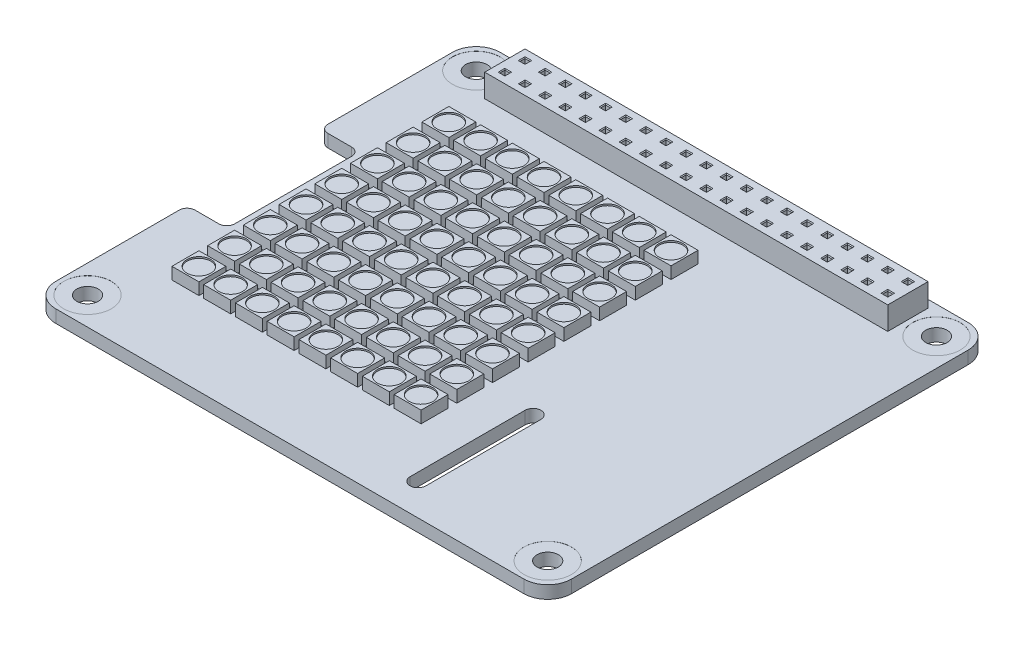
from build123d import *

# Parameters (mm, degrees)
BASES_W                    = 85
BASES_H                    = 56
BASE_DEPTH                 = 0.8
M2_5_CLEARANCE_HOLE_D      = 2.7
FASTENERAREA_START         = -0.01
FASTENERAREAS_R            = 3
FASTENERAREAS_R_2          = 1.35
FASTENERAREA_DEPTH         = 0.01
HLP_FASTENERHOLES_COUNT    = 2
HLP_FASTENERHOLES_PITCH    = 58
VM_FA_COPY_1_D             = 2.7
VM_START                   = -0.01
VM_FA_COPY_2_SKETCH_R      = 3
VM_FA_COPY_2_SKETCH_R_2    = 1.35
VM_FA_COPY_2_DEPTH         = 0.01
VM_FA_COPY_3_D             = 2.7
F_1_0_1_DIAMETER_HOLE_IO_D = 1
LP_DIAHOLE_IO_COUNT        = 20
LP_DIAHOLE_IO_PITCH        = 2.54
LP_DIAHOLE_IO_COUNT_DIR2   = 2
LP_DIAHOLE_IO_PITCH_DIR2   = 2.54
CORNERRADIUS_R             = 3
CUT_EXTRUDE1_DEPTH         = 51.919642575
FILLET1_R                  = 3
SKETCH10_W                 = 5
SKETCH10_H                 = 16.75
CUT_EXTRUDE2_DEPTH         = 51.919642575
FILLET2_R                  = 1
CUT_EXTRUDE3_DEPTH         = 51.919642575
SKETCH12_W                 = 50.8
SKETCH12_H                 = 5.08
BOSS_EXTRUDE1_DEPTH        = 5.8
SKETCH14_W                 = 0.64
SKETCH14_H                 = 0.64
CUT_EXTRUDE4_DEPTH         = 5.8
CHAMFER1_SIZE              = 0.3
LPATTERN1_COUNT            = 20
LPATTERN1_PITCH            = 2.54
LPATTERN1_COUNT_DIR2       = 2
LPATTERN1_PITCH_DIR2       = 2.54
CHAMFER1_OF_LPATTERN1_SIZE = 0.3
SKETCH15_W                 = 50.8
SKETCH15_H                 = 5.08
BOSS_EXTRUDE2_DEPTH        = 2.9
SKETCH16_W                 = 0.64
SKETCH16_H                 = 0.64
CUT_EXTRUDE5_DEPTH         = 2.9
CHAMFER2_SIZE              = 0.1
LPATTERN2_COUNT            = 20
LPATTERN2_PITCH            = 2.54
LPATTERN2_COUNT_DIR2       = 2
LPATTERN2_PITCH_DIR2       = 2.54
CHAMFER2_OF_LPATTERN2_SIZE = 0.1
SKETCH17_W                 = 3.4
SKETCH17_H                 = 3.4
BOSS_EXTRUDE3_DEPTH        = 1.5
SKETCH18_R                 = 1.5
CUT_EXTRUDE6_DEPTH         = 0.2
LPATTERN3_COUNT            = 8
LPATTERN3_PITCH            = 4.5
LPATTERN3_COUNT_DIR2       = 8
LPATTERN3_PITCH_DIR2       = 4


with BuildPart() as part:
    # BaseS → Base (new, symmetric)
    with BuildSketch(Plane(origin=(0, 0, 0), x_dir=(1, 0, 0), z_dir=(0, 1, 0))):
        Rectangle(BASES_W, BASES_H)
    extrude(amount=BASE_DEPTH, both=True)

    # M2.5 Clearance Hole (through all)
    with Locations(Plane(origin=(0, 0.8, 0), x_dir=(1, 0, 0), z_dir=(0, 1, 0))):
        with Locations((-39, 24.5), (-39, -24.5)):
            m2_5_clearance_hole = Hole(M2_5_CLEARANCE_HOLE_D / 2)

    # FastenerAreaS → FastenerArea (cut)
    # profile 1 of 2: a face of its own
    with BuildSketch(Plane(origin=(0, 0.8, 0), x_dir=(1, 0, 0), z_dir=(0, 1, 0)).offset(FASTENERAREA_START)):
        with Locations((-39, -24.5)):
            Circle(FASTENERAREAS_R)
        with Locations((-39, -24.5)):
            Circle(FASTENERAREAS_R_2, mode=Mode.SUBTRACT)
    # profile 2 of 2: a face of its own
    with BuildSketch(Plane(origin=(0, 0.8, 0), x_dir=(1, 0, 0), z_dir=(0, 1, 0)).offset(FASTENERAREA_START)):
        with Locations((-39, 24.5)):
            Circle(FASTENERAREAS_R)
        with Locations((-39, 24.5)):
            Circle(FASTENERAREAS_R_2, mode=Mode.SUBTRACT)
    fastenerarea = extrude(amount=FASTENERAREA_DEPTH, mode=Mode.SUBTRACT)

    # HLP FastenerHoles: M2.5 Clearance Hole, FastenerArea ×2
    with Locations(*[(i * HLP_FASTENERHOLES_PITCH, 0, 0) for i in range(1, HLP_FASTENERHOLES_COUNT)]):
        add(m2_5_clearance_hole, mode=Mode.SUBTRACT)
        add(fastenerarea, mode=Mode.SUBTRACT)

    # VM FA: FastenerArea across plane
    add(fastenerarea.mirror(Plane.ZX), mode=Mode.SUBTRACT)

    # VM FA copy 1 (through all)
    with Locations(Plane(origin=(58, -0.8, 0), x_dir=(1, 0, 0), z_dir=(0, -1, 0))):
        with Locations((-39, -24.5), (-39, 24.5)):
            Hole(VM_FA_COPY_1_D / 2)

    # VM FA copy 2 sketch → VM FA copy 2 (cut)
    # profile 1 of 2: a face of its own
    with BuildSketch(Plane(origin=(58, -0.8, 0), x_dir=(1, 0, 0), z_dir=(0, -1, 0)).offset(VM_START)):
        with Locations((-39, 24.5)):
            Circle(VM_FA_COPY_2_SKETCH_R)
        with Locations((-39, 24.5)):
            Circle(VM_FA_COPY_2_SKETCH_R_2, mode=Mode.SUBTRACT)
    # profile 2 of 2: a face of its own
    with BuildSketch(Plane(origin=(58, -0.8, 0), x_dir=(1, 0, 0), z_dir=(0, -1, 0)).offset(VM_START)):
        with Locations((-39, -24.5)):
            Circle(VM_FA_COPY_2_SKETCH_R)
        with Locations((-39, -24.5)):
            Circle(VM_FA_COPY_2_SKETCH_R_2, mode=Mode.SUBTRACT)
    extrude(amount=VM_FA_COPY_2_DEPTH, mode=Mode.SUBTRACT)

    # VM FA copy 3 (through all)
    with Locations(Plane.XZ.offset(0.8)):
        with Locations((-39, -24.5), (-39, 24.5)):
            Hole(VM_FA_COPY_3_D / 2)

    # Ø1.0 (1) Diameter Hole IO (through all)
    with Locations(Plane(origin=(0, 0.8, 0), x_dir=(1, 0, 0), z_dir=(0, 1, 0))):
        with Locations((-34.13, 25.77)):
            f_1_0_1_diameter_hole_io = Hole(F_1_0_1_DIAMETER_HOLE_IO_D / 2)

    # LP DiaHole IO: 1.0 _1_ Diameter Hole IO 20 × 2
    with Locations(*[(i * LP_DIAHOLE_IO_PITCH, 0, j * LP_DIAHOLE_IO_PITCH_DIR2) for i in range(LP_DIAHOLE_IO_COUNT) for j in range(LP_DIAHOLE_IO_COUNT_DIR2) if (i, j) != (0, 0)]):
        add(f_1_0_1_diameter_hole_io, mode=Mode.SUBTRACT)

    # CornerRadius
    cornerradius_edges = [part.edges().sort_by_distance(p)[0] for p in [
        (42.5, 0, -28),
        (42.5, 0, 28),
        (-42.5, 0, -28),
        (-42.5, 0, 28),
    ]]
    fillet(cornerradius_edges, radius=CORNERRADIUS_R)

    # Sketch9 → Cut-Extrude1 (cut, through all)
    with BuildSketch(Plane(origin=(0, 0.8, 0), x_dir=(1, 0, 0), z_dir=(0, 1, 0))):
        with BuildLine():
            Line((22.5, 28), (22.5, -28))
            Line((22.5, -28), (39.5, -28))
            ThreePointArc((39.5, -28), (41.621320344, -27.121320344), (42.5, -25))
            Line((42.5, -25), (42.5, 25))
            ThreePointArc((42.5, 25), (41.621320344, 27.121320344), (39.5, 28))
            Line((39.5, 28), (22.5, 28))
        make_face()
    extrude(amount=-CUT_EXTRUDE1_DEPTH, mode=Mode.SUBTRACT)

    # Fillet1
    fillet1_edges = [part.edges().sort_by_distance(p)[0] for p in [
        (22.5, 0, 28),
        (22.5, 0, -28),
    ]]
    fillet(fillet1_edges, radius=FILLET1_R)

    # Sketch10 → Cut-Extrude2 (cut, through all)
    with BuildSketch(Plane(origin=(0, 0.8, 0), x_dir=(1, 0, 0), z_dir=(0, 1, 0))):
        with Locations((-40, -0.075)):
            Rectangle(SKETCH10_W, SKETCH10_H)
    extrude(amount=-CUT_EXTRUDE2_DEPTH, mode=Mode.SUBTRACT)

    # Fillet2
    fillet2_edges = [part.edges().sort_by_distance(p)[0] for p in [
        (-42.5, 0, 8.45),
        (-37.5, 0, 8.45),
        (-37.5, 0, -8.3),
        (-42.5, 0, -8.3),
    ]]
    fillet(fillet2_edges, radius=FILLET2_R)

    # Sketch11 → Cut-Extrude3 (cut, through all)
    with BuildSketch(Plane(origin=(0, 0.8, 0), x_dir=(1, 0, 0), z_dir=(0, 1, 0))):
        with BuildLine():
            Line((3.15, -9.5), (3.15, -24))
            ThreePointArc((3.15, -24), (2.15, -25), (1.15, -24))
            Line((1.15, -24), (1.15, -9.5))
            ThreePointArc((1.15, -9.5), (2.15, -8.5), (3.15, -9.5))
        make_face()
    extrude(amount=-CUT_EXTRUDE3_DEPTH, mode=Mode.SUBTRACT)

    # Sketch12 → Boss-Extrude1 (add)
    with BuildSketch(Plane.XZ.offset(0.8)):
        with Locations((-10, -24.5)):
            Rectangle(SKETCH12_W, SKETCH12_H)
    extrude(amount=BOSS_EXTRUDE1_DEPTH)

    # Sketch14 → Cut-Extrude4 (cut)
    with BuildSketch(Plane.XZ.offset(6.6)):
        with Locations((14.13, -25.77)):
            Rectangle(SKETCH14_W, SKETCH14_H)
    cut_extrude4 = extrude(amount=-CUT_EXTRUDE4_DEPTH, mode=Mode.SUBTRACT)

    # Chamfer1
    chamfer1_edges = [part.edges().sort_by_distance(p)[0] for p in [
        (14.13, -6.6, -25.45),
        (14.45, -6.6, -25.77),
        (13.81, -6.6, -25.77),
        (14.13, -6.6, -26.09),
    ]]
    chamfer(chamfer1_edges, length=CHAMFER1_SIZE)

    # LPattern1: Cut-Extrude4 20 × 2
    with Locations(*[(-i * LPATTERN1_PITCH, 0, j * LPATTERN1_PITCH_DIR2) for i in range(LPATTERN1_COUNT) for j in range(LPATTERN1_COUNT_DIR2) if (i, j) != (0, 0)]):
        add(cut_extrude4, mode=Mode.SUBTRACT)

    # Chamfer1 of LPattern1
    chamfer1_of_lpattern1_edges = [part.edges().sort_by_distance(p)[0] for p in [
        (14.13, -6.6, -22.91),
        (14.45, -6.6, -23.23),
        (13.81, -6.6, -23.23),
        (14.13, -6.6, -23.55),
        (11.59, -6.6, -25.45),
        (11.91, -6.6, -25.77),
        (11.27, -6.6, -25.77),
        (11.59, -6.6, -26.09),
        (11.59, -6.6, -22.91),
        (11.91, -6.6, -23.23),
        (11.27, -6.6, -23.23),
        (11.59, -6.6, -23.55),
        (9.05, -6.6, -25.45),
        (9.37, -6.6, -25.77),
        (8.73, -6.6, -25.77),
        (9.05, -6.6, -26.09),
        (9.05, -6.6, -22.91),
        (9.37, -6.6, -23.23),
        (8.73, -6.6, -23.23),
        (9.05, -6.6, -23.55),
        (6.51, -6.6, -25.45),
        (6.83, -6.6, -25.77),
        (6.19, -6.6, -25.77),
        (6.51, -6.6, -26.09),
        (6.51, -6.6, -22.91),
        (6.83, -6.6, -23.23),
        (6.19, -6.6, -23.23),
        (6.51, -6.6, -23.55),
        (3.97, -6.6, -25.45),
        (4.29, -6.6, -25.77),
        (3.65, -6.6, -25.77),
        (3.97, -6.6, -26.09),
        (3.97, -6.6, -22.91),
        (4.29, -6.6, -23.23),
        (3.65, -6.6, -23.23),
        (3.97, -6.6, -23.55),
        (1.43, -6.6, -25.45),
        (1.75, -6.6, -25.77),
        (1.11, -6.6, -25.77),
        (1.43, -6.6, -26.09),
        (1.43, -6.6, -22.91),
        (1.75, -6.6, -23.23),
        (1.11, -6.6, -23.23),
        (1.43, -6.6, -23.55),
        (-1.11, -6.6, -25.45),
        (-0.79, -6.6, -25.77),
        (-1.43, -6.6, -25.77),
        (-1.11, -6.6, -26.09),
        (-1.11, -6.6, -22.91),
        (-0.79, -6.6, -23.23),
        (-1.43, -6.6, -23.23),
        (-1.11, -6.6, -23.55),
        (-3.65, -6.6, -25.45),
        (-3.33, -6.6, -25.77),
        (-3.97, -6.6, -25.77),
        (-3.65, -6.6, -26.09),
        (-3.65, -6.6, -22.91),
        (-3.33, -6.6, -23.23),
        (-3.97, -6.6, -23.23),
        (-3.65, -6.6, -23.55),
        (-6.19, -6.6, -25.45),
        (-5.87, -6.6, -25.77),
        (-6.51, -6.6, -25.77),
        (-6.19, -6.6, -26.09),
        (-6.19, -6.6, -22.91),
        (-5.87, -6.6, -23.23),
        (-6.51, -6.6, -23.23),
        (-6.19, -6.6, -23.55),
        (-8.73, -6.6, -25.45),
        (-8.41, -6.6, -25.77),
        (-9.05, -6.6, -25.77),
        (-8.73, -6.6, -26.09),
        (-8.73, -6.6, -22.91),
        (-8.41, -6.6, -23.23),
        (-9.05, -6.6, -23.23),
        (-8.73, -6.6, -23.55),
        (-11.27, -6.6, -25.45),
        (-10.95, -6.6, -25.77),
        (-11.59, -6.6, -25.77),
        (-11.27, -6.6, -26.09),
        (-11.27, -6.6, -22.91),
        (-10.95, -6.6, -23.23),
        (-11.59, -6.6, -23.23),
        (-11.27, -6.6, -23.55),
        (-13.81, -6.6, -25.45),
        (-13.49, -6.6, -25.77),
        (-14.13, -6.6, -25.77),
        (-13.81, -6.6, -26.09),
        (-13.81, -6.6, -22.91),
        (-13.49, -6.6, -23.23),
        (-14.13, -6.6, -23.23),
        (-13.81, -6.6, -23.55),
        (-16.35, -6.6, -25.45),
        (-16.03, -6.6, -25.77),
        (-16.67, -6.6, -25.77),
        (-16.35, -6.6, -26.09),
        (-16.35, -6.6, -22.91),
        (-16.03, -6.6, -23.23),
        (-16.67, -6.6, -23.23),
        (-16.35, -6.6, -23.55),
        (-18.89, -6.6, -25.45),
        (-18.57, -6.6, -25.77),
        (-19.21, -6.6, -25.77),
        (-18.89, -6.6, -26.09),
        (-18.89, -6.6, -22.91),
        (-18.57, -6.6, -23.23),
        (-19.21, -6.6, -23.23),
        (-18.89, -6.6, -23.55),
        (-21.43, -6.6, -25.45),
        (-21.11, -6.6, -25.77),
        (-21.75, -6.6, -25.77),
        (-21.43, -6.6, -26.09),
        (-21.43, -6.6, -22.91),
        (-21.11, -6.6, -23.23),
        (-21.75, -6.6, -23.23),
        (-21.43, -6.6, -23.55),
        (-23.97, -6.6, -25.45),
        (-23.65, -6.6, -25.77),
        (-24.29, -6.6, -25.77),
        (-23.97, -6.6, -26.09),
        (-23.97, -6.6, -22.91),
        (-23.65, -6.6, -23.23),
        (-24.29, -6.6, -23.23),
        (-23.97, -6.6, -23.55),
        (-26.51, -6.6, -25.45),
        (-26.19, -6.6, -25.77),
        (-26.83, -6.6, -25.77),
        (-26.51, -6.6, -26.09),
        (-26.51, -6.6, -22.91),
        (-26.19, -6.6, -23.23),
        (-26.83, -6.6, -23.23),
        (-26.51, -6.6, -23.55),
        (-29.05, -6.6, -25.45),
        (-28.73, -6.6, -25.77),
        (-29.37, -6.6, -25.77),
        (-29.05, -6.6, -26.09),
        (-29.05, -6.6, -22.91),
        (-28.73, -6.6, -23.23),
        (-29.37, -6.6, -23.23),
        (-29.05, -6.6, -23.55),
        (-31.59, -6.6, -25.45),
        (-31.27, -6.6, -25.77),
        (-31.91, -6.6, -25.77),
        (-31.59, -6.6, -26.09),
        (-31.59, -6.6, -22.91),
        (-31.27, -6.6, -23.23),
        (-31.91, -6.6, -23.23),
        (-31.59, -6.6, -23.55),
        (-34.13, -6.6, -25.45),
        (-33.81, -6.6, -25.77),
        (-34.45, -6.6, -25.77),
        (-34.13, -6.6, -26.09),
        (-34.13, -6.6, -22.91),
        (-33.81, -6.6, -23.23),
        (-34.45, -6.6, -23.23),
        (-34.13, -6.6, -23.55),
    ]]
    chamfer(chamfer1_of_lpattern1_edges, length=CHAMFER1_OF_LPATTERN1_SIZE)

    # Sketch15 → Boss-Extrude2 (add)
    with BuildSketch(Plane(origin=(0, 0.8, 0), x_dir=(1, 0, 0), z_dir=(0, 1, 0))):
        with Locations((-10, 24.5)):
            Rectangle(SKETCH15_W, SKETCH15_H)
    extrude(amount=BOSS_EXTRUDE2_DEPTH)

    # Sketch16 → Cut-Extrude5 (cut)
    with BuildSketch(Plane(origin=(0, 3.7, 0), x_dir=(1, 0, 0), z_dir=(0, 1, 0))):
        with Locations((-34.13, 25.77)):
            Rectangle(SKETCH16_W, SKETCH16_H)
    cut_extrude5 = extrude(amount=-CUT_EXTRUDE5_DEPTH, mode=Mode.SUBTRACT)

    # Chamfer2
    chamfer2_edges = [part.edges().sort_by_distance(p)[0] for p in [
        (-33.81, 3.7, -25.77),
        (-34.13, 3.7, -26.09),
        (-34.45, 3.7, -25.77),
        (-34.13, 3.7, -25.45),
    ]]
    chamfer(chamfer2_edges, length=CHAMFER2_SIZE)

    # LPattern2: Cut-Extrude5 20 × 2
    with Locations(*[(i * LPATTERN2_PITCH, 0, j * LPATTERN2_PITCH_DIR2) for i in range(LPATTERN2_COUNT) for j in range(LPATTERN2_COUNT_DIR2) if (i, j) != (0, 0)]):
        add(cut_extrude5, mode=Mode.SUBTRACT)

    # Chamfer2 of LPattern2
    chamfer2_of_lpattern2_edges = [part.edges().sort_by_distance(p)[0] for p in [
        (-33.81, 3.7, -23.23),
        (-34.13, 3.7, -23.55),
        (-34.45, 3.7, -23.23),
        (-34.13, 3.7, -22.91),
        (-31.27, 3.7, -25.77),
        (-31.59, 3.7, -26.09),
        (-31.91, 3.7, -25.77),
        (-31.59, 3.7, -25.45),
        (-31.27, 3.7, -23.23),
        (-31.59, 3.7, -23.55),
        (-31.91, 3.7, -23.23),
        (-31.59, 3.7, -22.91),
        (-28.73, 3.7, -25.77),
        (-29.05, 3.7, -26.09),
        (-29.37, 3.7, -25.77),
        (-29.05, 3.7, -25.45),
        (-28.73, 3.7, -23.23),
        (-29.05, 3.7, -23.55),
        (-29.37, 3.7, -23.23),
        (-29.05, 3.7, -22.91),
        (-26.19, 3.7, -25.77),
        (-26.51, 3.7, -26.09),
        (-26.83, 3.7, -25.77),
        (-26.51, 3.7, -25.45),
        (-26.19, 3.7, -23.23),
        (-26.51, 3.7, -23.55),
        (-26.83, 3.7, -23.23),
        (-26.51, 3.7, -22.91),
        (-23.65, 3.7, -25.77),
        (-23.97, 3.7, -26.09),
        (-24.29, 3.7, -25.77),
        (-23.97, 3.7, -25.45),
        (-23.65, 3.7, -23.23),
        (-23.97, 3.7, -23.55),
        (-24.29, 3.7, -23.23),
        (-23.97, 3.7, -22.91),
        (-21.11, 3.7, -25.77),
        (-21.43, 3.7, -26.09),
        (-21.75, 3.7, -25.77),
        (-21.43, 3.7, -25.45),
        (-21.11, 3.7, -23.23),
        (-21.43, 3.7, -23.55),
        (-21.75, 3.7, -23.23),
        (-21.43, 3.7, -22.91),
        (-18.57, 3.7, -25.77),
        (-18.89, 3.7, -26.09),
        (-19.21, 3.7, -25.77),
        (-18.89, 3.7, -25.45),
        (-18.57, 3.7, -23.23),
        (-18.89, 3.7, -23.55),
        (-19.21, 3.7, -23.23),
        (-18.89, 3.7, -22.91),
        (-16.03, 3.7, -25.77),
        (-16.35, 3.7, -26.09),
        (-16.67, 3.7, -25.77),
        (-16.35, 3.7, -25.45),
        (-16.03, 3.7, -23.23),
        (-16.35, 3.7, -23.55),
        (-16.67, 3.7, -23.23),
        (-16.35, 3.7, -22.91),
        (-13.49, 3.7, -25.77),
        (-13.81, 3.7, -26.09),
        (-14.13, 3.7, -25.77),
        (-13.81, 3.7, -25.45),
        (-13.49, 3.7, -23.23),
        (-13.81, 3.7, -23.55),
        (-14.13, 3.7, -23.23),
        (-13.81, 3.7, -22.91),
        (-10.95, 3.7, -25.77),
        (-11.27, 3.7, -26.09),
        (-11.59, 3.7, -25.77),
        (-11.27, 3.7, -25.45),
        (-10.95, 3.7, -23.23),
        (-11.27, 3.7, -23.55),
        (-11.59, 3.7, -23.23),
        (-11.27, 3.7, -22.91),
        (-8.41, 3.7, -25.77),
        (-8.73, 3.7, -26.09),
        (-9.05, 3.7, -25.77),
        (-8.73, 3.7, -25.45),
        (-8.41, 3.7, -23.23),
        (-8.73, 3.7, -23.55),
        (-9.05, 3.7, -23.23),
        (-8.73, 3.7, -22.91),
        (-5.87, 3.7, -25.77),
        (-6.19, 3.7, -26.09),
        (-6.51, 3.7, -25.77),
        (-6.19, 3.7, -25.45),
        (-5.87, 3.7, -23.23),
        (-6.19, 3.7, -23.55),
        (-6.51, 3.7, -23.23),
        (-6.19, 3.7, -22.91),
        (-3.33, 3.7, -25.77),
        (-3.65, 3.7, -26.09),
        (-3.97, 3.7, -25.77),
        (-3.65, 3.7, -25.45),
        (-3.33, 3.7, -23.23),
        (-3.65, 3.7, -23.55),
        (-3.97, 3.7, -23.23),
        (-3.65, 3.7, -22.91),
        (-0.79, 3.7, -25.77),
        (-1.11, 3.7, -26.09),
        (-1.43, 3.7, -25.77),
        (-1.11, 3.7, -25.45),
        (-0.79, 3.7, -23.23),
        (-1.11, 3.7, -23.55),
        (-1.43, 3.7, -23.23),
        (-1.11, 3.7, -22.91),
        (1.75, 3.7, -25.77),
        (1.43, 3.7, -26.09),
        (1.11, 3.7, -25.77),
        (1.43, 3.7, -25.45),
        (1.75, 3.7, -23.23),
        (1.43, 3.7, -23.55),
        (1.11, 3.7, -23.23),
        (1.43, 3.7, -22.91),
        (4.29, 3.7, -25.77),
        (3.97, 3.7, -26.09),
        (3.65, 3.7, -25.77),
        (3.97, 3.7, -25.45),
        (4.29, 3.7, -23.23),
        (3.97, 3.7, -23.55),
        (3.65, 3.7, -23.23),
        (3.97, 3.7, -22.91),
        (6.83, 3.7, -25.77),
        (6.51, 3.7, -26.09),
        (6.19, 3.7, -25.77),
        (6.51, 3.7, -25.45),
        (6.83, 3.7, -23.23),
        (6.51, 3.7, -23.55),
        (6.19, 3.7, -23.23),
        (6.51, 3.7, -22.91),
        (9.37, 3.7, -25.77),
        (9.05, 3.7, -26.09),
        (8.73, 3.7, -25.77),
        (9.05, 3.7, -25.45),
        (9.37, 3.7, -23.23),
        (9.05, 3.7, -23.55),
        (8.73, 3.7, -23.23),
        (9.05, 3.7, -22.91),
        (11.91, 3.7, -25.77),
        (11.59, 3.7, -26.09),
        (11.27, 3.7, -25.77),
        (11.59, 3.7, -25.45),
        (11.91, 3.7, -23.23),
        (11.59, 3.7, -23.55),
        (11.27, 3.7, -23.23),
        (11.59, 3.7, -22.91),
        (14.45, 3.7, -25.77),
        (14.13, 3.7, -26.09),
        (13.81, 3.7, -25.77),
        (14.13, 3.7, -25.45),
        (14.45, 3.7, -23.23),
        (14.13, 3.7, -23.55),
        (13.81, 3.7, -23.23),
        (14.13, 3.7, -22.91),
    ]]
    chamfer(chamfer2_of_lpattern2_edges, length=CHAMFER2_OF_LPATTERN2_SIZE)

    # Sketch17 → Boss-Extrude3 (add)
    with BuildSketch(Plane(origin=(0, 0.8, 0), x_dir=(1, 0, 0), z_dir=(0, 1, 0))):
        with Locations((-33.62, 15.66)):
            Rectangle(SKETCH17_W, SKETCH17_H)
    boss_extrude3 = extrude(amount=BOSS_EXTRUDE3_DEPTH)

    # Sketch18 → Cut-Extrude6 (cut)
    with BuildSketch(Plane(origin=(0, 2.3, 0), x_dir=(1, 0, 0), z_dir=(0, 1, 0))):
        with Locations((-33.62, 15.66)):
            Circle(SKETCH18_R)
    cut_extrude6 = extrude(amount=-CUT_EXTRUDE6_DEPTH, mode=Mode.SUBTRACT)

    # LPattern3: Boss-Extrude3, Cut-Extrude6 8 × 8
    with Locations(*[(j * LPATTERN3_PITCH_DIR2, 0, i * LPATTERN3_PITCH) for i in range(LPATTERN3_COUNT) for j in range(LPATTERN3_COUNT_DIR2) if (i, j) != (0, 0)]):
        add(boss_extrude3)
        add(cut_extrude6, mode=Mode.SUBTRACT)


solid = part.part
